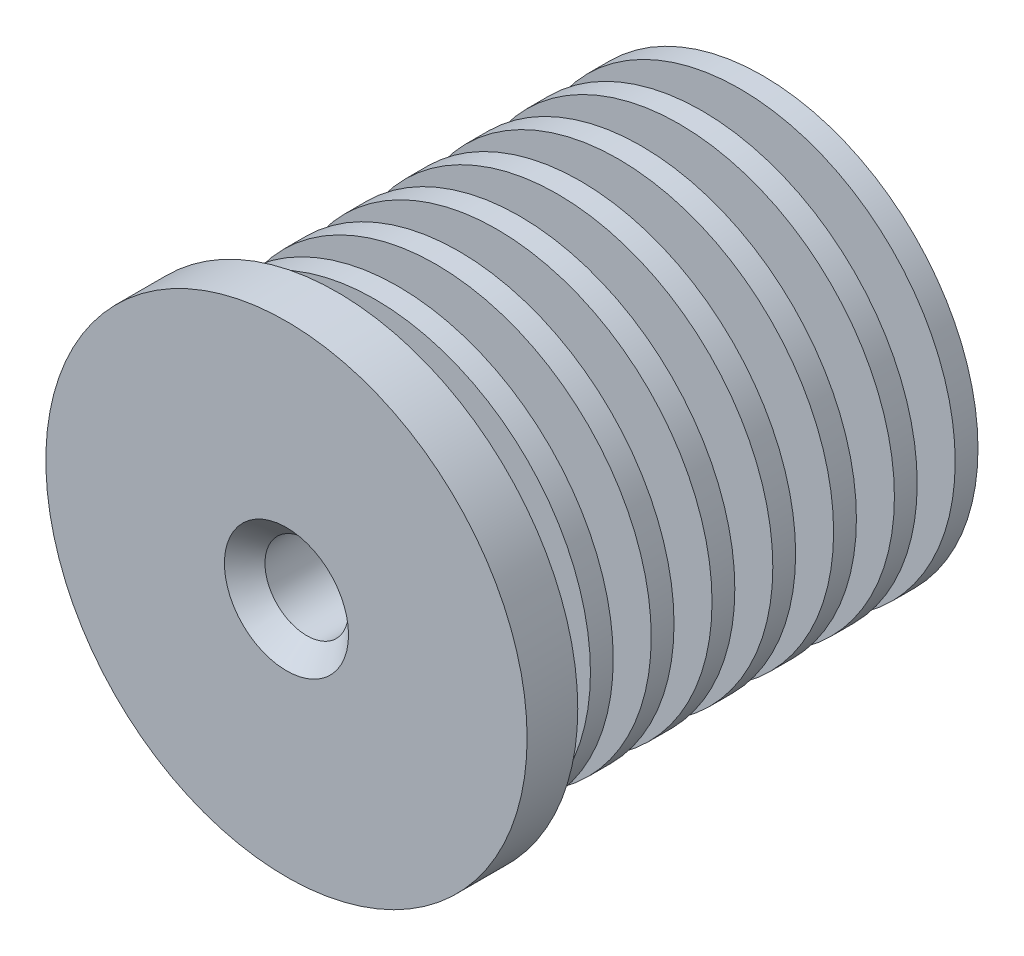
from build123d import *

# Parameters (mm, degrees)
CHAMFER1_SIZE = 0.8


with BuildPart() as part:
    # Sketch2 → Revolve1 (revolve)
    with BuildSketch(Plane(origin=(0, 0, 0), x_dir=(1, 0, 0), z_dir=(0, 1, 0))):
        Polygon((1.65, 18.8), (1.65, 0), (9.5, 0), (9.5, 2), (6, 2), (6, 3.5), (8.5, 3.5), (8.5, 4.4), (3.5, 4.4), (3.5, 5.9), (8.5, 5.9), (8.5, 6.8), (3.5, 6.8), (3.5, 8.3), (8.5, 8.3), (8.5, 9.2), (3.5, 9.2), (3.5, 10.7), (8.5, 10.7), (8.5, 11.6), (3.5, 11.6), (3.5, 13.1), (8.5, 13.1), (8.5, 14), (3.5, 14), (3.5, 15.5), (8.5, 15.5), (8.5, 16.4), (3.5, 16.4), (3.5, 17.9), (8.5, 17.9), (8.5, 18.8), align=None)
    revolve(axis=Axis((0, 0, 0), (0, 0, -1)))

    # Chamfer1
    chamfer1_edges = [part.edges().sort_by_distance(p)[0] for p in [
        (-1.65, 0, 0),
    ]]
    chamfer(chamfer1_edges, length=CHAMFER1_SIZE)

    # Sketch4 → Cut-Revolve1 (revolve, cut)
    with BuildSketch(Plane(origin=(0, 0, 0), x_dir=(1, 0, 0), z_dir=(0, 1, 0))):
        Polygon((0, 7.529612721), (1.65, 7.529612721), (2.1, 7.8), (2.1, 11.559655752), (2.5, 11.8), (2.5, 18.8), (0, 18.8), align=None)
    revolve(axis=Axis((0, 0, -18.8), (0, 0, 1)), mode=Mode.SUBTRACT)


solid = part.part
